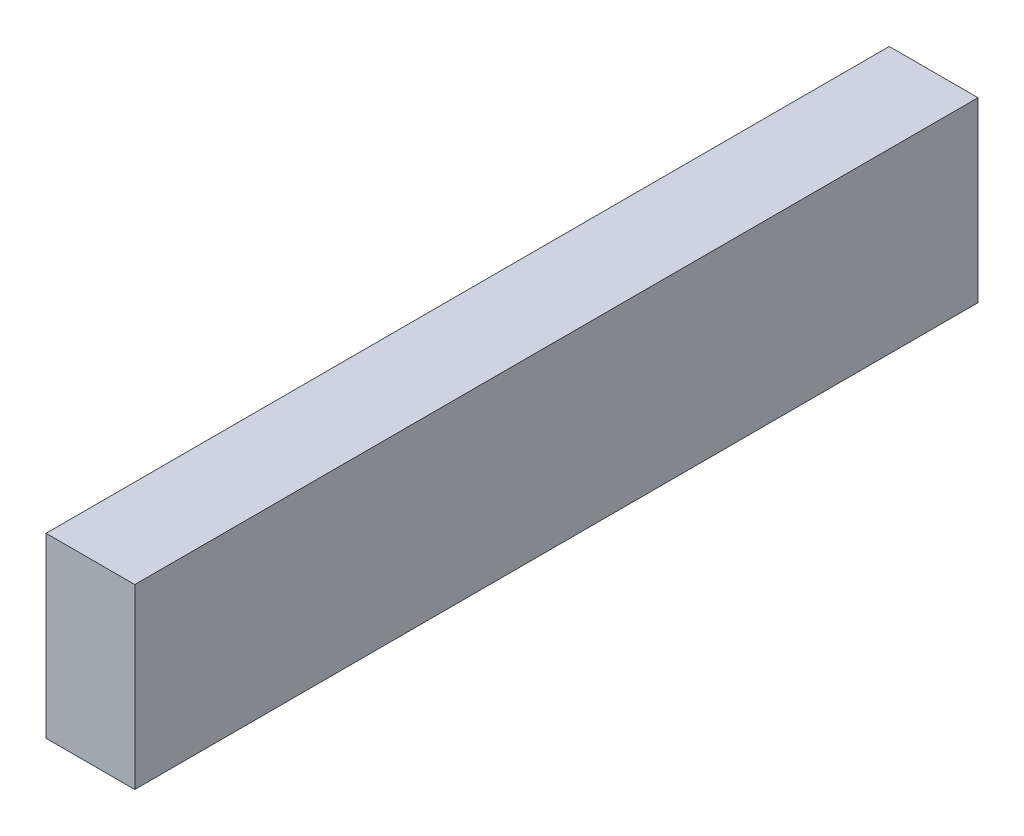
from build123d import *

# Parameters (mm, degrees)
SKETCH1_W           = 20
SKETCH1_H           = 40
BOSS_EXTRUDE1_DEPTH = 190


with BuildPart() as part:
    # Sketch1 → Boss-Extrude1 (new body)
    with BuildSketch(Plane.XY):
        with Locations((220, 20)):
            Rectangle(SKETCH1_W, SKETCH1_H)
    extrude(amount=BOSS_EXTRUDE1_DEPTH)


solid = part.part
